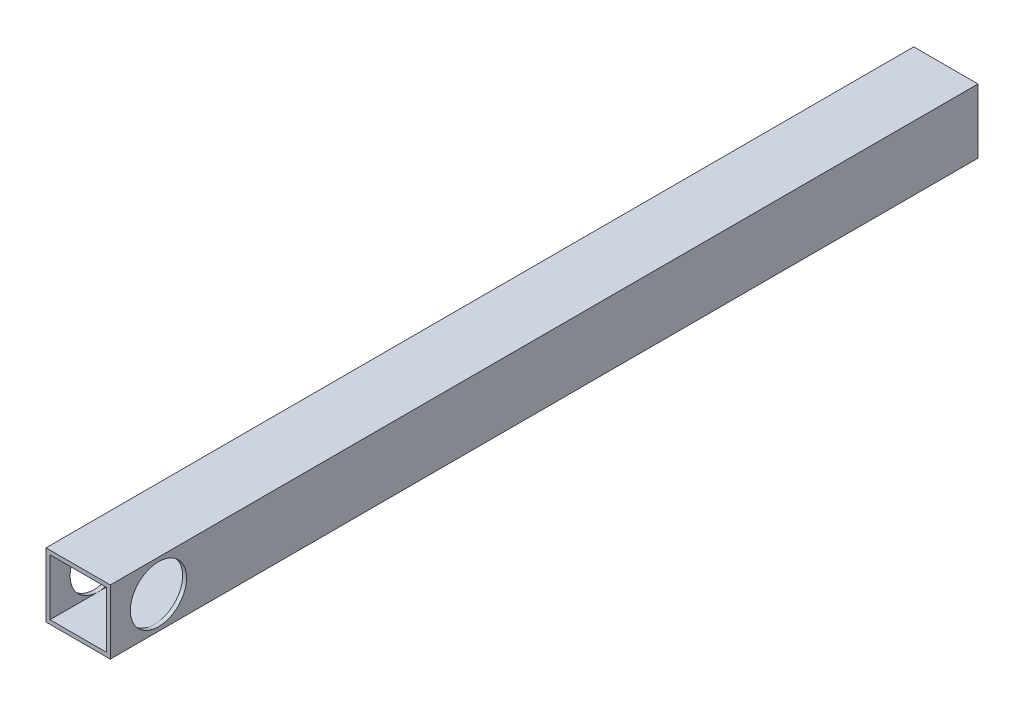
from build123d import *

# Parameters (mm, degrees)
SKETCH1_W           = 25.4
SKETCH1_H           = 25.4
SKETCH1_W_2         = 22.225
SKETCH1_H_2         = 22.225
EXTRUDE_THIN1_DEPTH = 342.9
SKETCH2_R           = 11.1125
CUT_EXTRUDE1_DEPTH  = 345.073916477


with BuildPart() as part:
    # Sketch1 → Extrude-Thin1 (new body)
    with BuildSketch(Plane.XY):
        Rectangle(SKETCH1_W, SKETCH1_H)
        Rectangle(SKETCH1_W_2, SKETCH1_H_2, mode=Mode.SUBTRACT)
    extrude(amount=EXTRUDE_THIN1_DEPTH)

    # Sketch2 → Cut-Extrude1 (cut, through all)
    with BuildSketch(Plane(origin=(12.7, 0, 0), x_dir=(0, 0, -1), z_dir=(1, 0, 0))):
        with Locations((-323.85, 0)):
            Circle(SKETCH2_R)
    extrude(amount=-CUT_EXTRUDE1_DEPTH, mode=Mode.SUBTRACT)


solid = part.part
